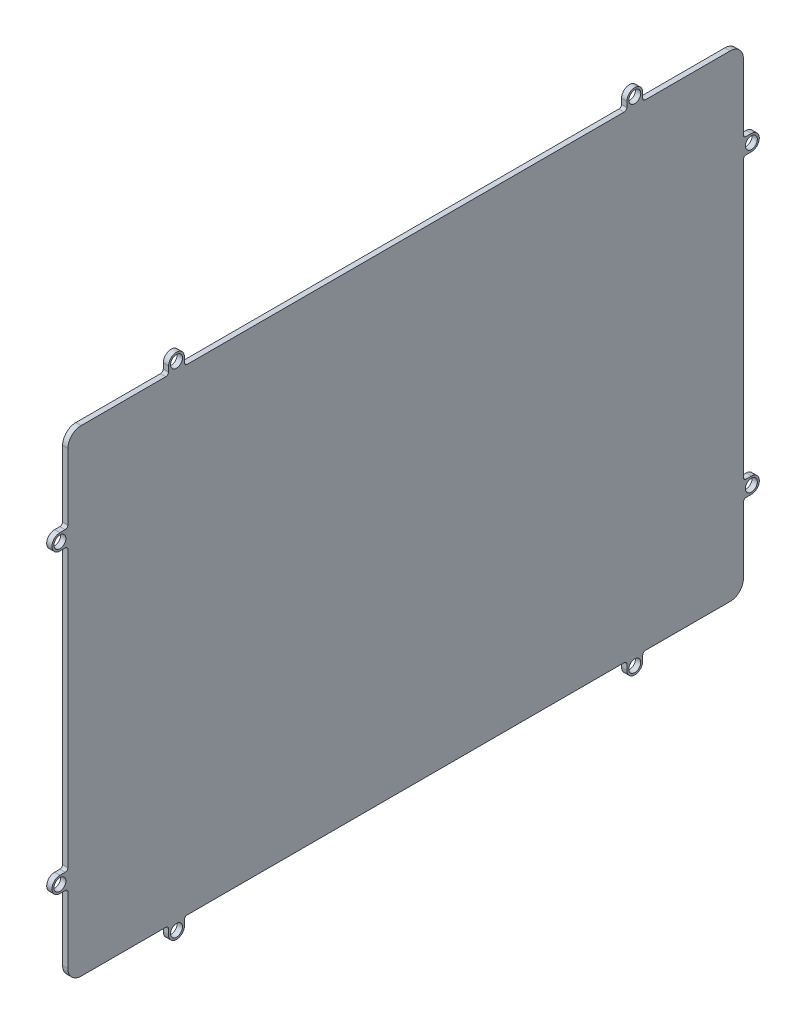
from build123d import *

# Parameters (mm, degrees)
IZIM1_R                     = 1.6
Y_KSEKLIK_EKSTR_ZYON1_DEPTH = 2
IZIM2_R                     = 2.25
KES_EKSTR_ZYON1_DEPTH       = 2
Y_Z_TA_1_OUTLINE_R          = 2.25
Y_Z_TA_1_DEPTH              = 2
Y_Z_TA_1_2_OUTLINE_R        = 2.25
Y_Z_TA_1_2_DEPTH            = 2


# Read off the part's stored shape, not the designer's step: Yüzü Taşı1
with BuildPart() as part:
    # Çizim1 → Yükseklik-Ekstrüzyon1 (new body)
    with BuildSketch(Plane.YZ):
        with BuildLine():
            Line((78.998248848, 127.350175115), (53.998248848, 127.350175115))
            ThreePointArc((53.998248848, 127.350175115), (53.291142067, 127.643068334), (52.998248848, 128.350175115))
            Line((52.998248848, 128.350175115), (52.998248848, 130.350175115))
            ThreePointArc((52.998248848, 130.350175115), (49.998248848, 133.350175115), (46.998248848, 130.350175115))
            Line((46.998248848, 130.350175115), (46.998248848, 128.350175115))
            ThreePointArc((46.998248848, 128.350175115), (46.705355629, 127.643068334), (45.998248848, 127.350175115))
            Line((45.998248848, 127.350175115), (-43.001751152, 127.350175115))
            ThreePointArc((-43.001751152, 127.350175115), (-43.708857933, 127.643068334), (-44.001751152, 128.350175115))
            Line((-44.001751152, 128.350175115), (-44.001751152, 130.350175115))
            ThreePointArc((-44.001751152, 130.350175115), (-47.001751152, 133.350175115), (-50.001751152, 130.350175115))
            Line((-50.001751152, 130.350175115), (-50.001751152, 128.350175115))
            ThreePointArc((-50.001751152, 128.350175115), (-50.294644371, 127.643068334), (-51.001751152, 127.350175115))
            Line((-51.001751152, 127.350175115), (-76.001751152, 127.350175115))
            ThreePointArc((-76.001751152, 127.350175115), (-79.537285058, 125.885709021), (-81.001751152, 122.350175115))
            Line((-81.001751152, 122.350175115), (-81.001751152, 90.350175115))
            ThreePointArc((-81.001751152, 90.350175115), (-81.294644371, 89.643068334), (-82.001751152, 89.350175115))
            Line((-82.001751152, 89.350175115), (-84.001751152, 89.350175115))
            ThreePointArc((-84.001751152, 89.350175115), (-87.001751152, 86.350175115), (-84.001751152, 83.350175115))
            Line((-84.001751152, 83.350175115), (-82.001751152, 83.350175115))
            ThreePointArc((-82.001751152, 83.350175115), (-81.294644371, 83.057281896), (-81.001751152, 82.350175115))
            Line((-81.001751152, 82.350175115), (-81.001751152, -82.649824885))
            ThreePointArc((-81.001751152, -82.649824885), (-81.294644371, -83.356931666), (-82.001751152, -83.649824885))
            Line((-82.001751152, -83.649824885), (-84.001751152, -83.649824885))
            ThreePointArc((-84.001751152, -83.649824885), (-87.001751152, -86.649824885), (-84.001751152, -89.649824885))
            Line((-84.001751152, -89.649824885), (-82.001751152, -89.649824885))
            ThreePointArc((-82.001751152, -89.649824885), (-81.294644371, -89.942718104), (-81.001751152, -90.649824885))
            Line((-81.001751152, -90.649824885), (-81.001751152, -122.649824885))
            ThreePointArc((-81.001751152, -122.649824885), (-79.537285058, -126.185358791), (-76.001751152, -127.649824885))
            Line((-76.001751152, -127.649824885), (-51.001751152, -127.649824885))
            ThreePointArc((-51.001751152, -127.649824885), (-50.294644371, -127.942718104), (-50.001751152, -128.649824885))
            Line((-50.001751152, -128.649824885), (-50.001751152, -130.649824885))
            ThreePointArc((-50.001751152, -130.649824885), (-47.001751152, -133.649824885), (-44.001751152, -130.649824885))
            Line((-44.001751152, -130.649824885), (-44.001751152, -128.649824885))
            ThreePointArc((-44.001751152, -128.649824885), (-43.708857933, -127.942718104), (-43.001751152, -127.649824885))
            Line((-43.001751152, -127.649824885), (45.998248848, -127.649824885))
            ThreePointArc((45.998248848, -127.649824885), (46.705355629, -127.942718104), (46.998248848, -128.649824885))
            Line((46.998248848, -128.649824885), (46.998248848, -130.649824885))
            ThreePointArc((46.998248848, -130.649824885), (49.998248848, -133.649824885), (52.998248848, -130.649824885))
            Line((52.998248848, -130.649824885), (52.998248848, -128.649824885))
            ThreePointArc((52.998248848, -128.649824885), (53.291142067, -127.942718104), (53.998248848, -127.649824885))
            Line((53.998248848, -127.649824885), (78.998248848, -127.649824885))
            ThreePointArc((78.998248848, -127.649824885), (82.533782754, -126.185358791), (83.998248848, -122.649824885))
            Line((83.998248848, -122.649824885), (83.998248848, -90.649824885))
            ThreePointArc((83.998248848, -90.649824885), (84.291142067, -89.942718104), (84.998248848, -89.649824885))
            Line((84.998248848, -89.649824885), (86.998248848, -89.649824885))
            ThreePointArc((86.998248848, -89.649824885), (89.998248848, -86.649824885), (86.998248848, -83.649824885))
            Line((86.998248848, -83.649824885), (84.998248848, -83.649824885))
            ThreePointArc((84.998248848, -83.649824885), (84.291142067, -83.356931666), (83.998248848, -82.649824885))
            Line((83.998248848, -82.649824885), (83.998248848, 82.350175115))
            ThreePointArc((83.998248848, 82.350175115), (84.291142067, 83.057281896), (84.998248848, 83.350175115))
            Line((84.998248848, 83.350175115), (86.998248848, 83.350175115))
            ThreePointArc((86.998248848, 83.350175115), (89.998248848, 86.350175115), (86.998248848, 89.350175115))
            Line((86.998248848, 89.350175115), (84.998248848, 89.350175115))
            ThreePointArc((84.998248848, 89.350175115), (84.291142067, 89.643068334), (83.998248848, 90.350175115))
            Line((83.998248848, 90.350175115), (83.998248848, 122.350175115))
            ThreePointArc((83.998248848, 122.350175115), (82.533782754, 125.885709021), (78.998248848, 127.350175115))
        make_face()
        with Locations(Location((-84.001751152, -86.649824885, 0), (0, 0, 270))):
            Circle(IZIM1_R, mode=Mode.SUBTRACT)
        with Locations(Location((-47.001751152, -130.649824885, 0), (0, 0, 270))):
            Circle(IZIM1_R, mode=Mode.SUBTRACT)
        with Locations(Location((49.998248848, -130.649824885, 0), (0, 0, 270))):
            Circle(IZIM1_R, mode=Mode.SUBTRACT)
        with Locations(Location((86.998248848, -86.649824885, 0), (0, 0, 270))):
            Circle(IZIM1_R, mode=Mode.SUBTRACT)
        with Locations(Location((86.998248848, 86.350175115, 0), (0, 0, 270))):
            Circle(IZIM1_R, mode=Mode.SUBTRACT)
        with Locations(Location((49.998248848, 130.350175115, 0), (0, 0, 270))):
            Circle(IZIM1_R, mode=Mode.SUBTRACT)
        with Locations(Location((-47.001751152, 130.350175115, 0), (0, 0, 270))):
            Circle(IZIM1_R, mode=Mode.SUBTRACT)
        with Locations(Location((-84.001751152, 86.350175115, 0), (0, 0, 270))):
            Circle(IZIM1_R, mode=Mode.SUBTRACT)
    extrude(amount=Y_KSEKLIK_EKSTR_ZYON1_DEPTH)

    # Çizim2 → Kes-Ekstrüzyon1 (cut)
    with BuildSketch(Plane.YZ.offset(2)):
        with Locations(Location((-84.001751152, 86.350175115, 0), (0, 0, 270))):
            Circle(IZIM2_R)
    kes_ekstr_zyon1 = extrude(amount=-KES_EKSTR_ZYON1_DEPTH, mode=Mode.SUBTRACT)

    # Çizim-Çoğaltma1: Kes-Ekstrüzyon1 at 7 more places
    with Locations((0, 37, 44), (0, 134, 44), (0, 171, 0), (0, 171, -173), (0, 134, -217), (0, 37, -217), (0, 0, -173)):
        add(kes_ekstr_zyon1, mode=Mode.SUBTRACT)

    # Yüzü Taşı1 outline → Yüzü Taşı1 (cut)
    # profile 1 of 2: a face of its own
    with BuildSketch(Plane.YZ):
        with BuildLine():
            ThreePointArc((-50.001751152, 128.350175115), (-50.294644371, 127.643068334), (-51.001751152, 127.350175115))
            Line((-51.001751152, 127.350175115), (-43.001751152, 127.350175115))
            ThreePointArc((-43.001751152, 127.350175115), (-43.708857933, 127.643068334), (-44.001751152, 128.350175115))
            Line((-44.001751152, 128.350175115), (-44.001751152, 130.350175115))
            ThreePointArc((-44.001751152, 130.350175115), (-47.001751152, 133.350175115), (-50.001751152, 130.350175115))
            Line((-50.001751152, 130.350175115), (-50.001751152, 128.350175115))
        make_face()
        with Locations((-47.001751152, 130.350175115)):
            Circle(Y_Z_TA_1_OUTLINE_R, mode=Mode.SUBTRACT)
    # profile 2 of 2: a face of its own
    with BuildSketch(Plane.YZ):
        with BuildLine():
            Line((-43.001751152, -127.649824885), (-51.001751152, -127.649824885))
            ThreePointArc((-51.001751152, -127.649824885), (-50.294644371, -127.942718104), (-50.001751152, -128.649824885))
            Line((-50.001751152, -128.649824885), (-50.001751152, -130.649824885))
            ThreePointArc((-50.001751152, -130.649824885), (-47.001751152, -133.649824885), (-44.001751152, -130.649824885))
            Line((-44.001751152, -130.649824885), (-44.001751152, -128.649824885))
            ThreePointArc((-44.001751152, -128.649824885), (-43.708857933, -127.942718104), (-43.001751152, -127.649824885))
        make_face()
        with Locations((-47.001751152, -130.649824885)):
            Circle(Y_Z_TA_1_OUTLINE_R, mode=Mode.SUBTRACT)
    extrude(amount=Y_Z_TA_1_DEPTH, mode=Mode.SUBTRACT)

    # Y_z_ Ta_1 2 outline → Y_z_ Ta_1 2 (add)
    # profile 1 of 5: a face of its own
    with BuildSketch(Plane.YZ):
        with BuildLine():
            Line((-66.001751152, 127.350175115), (-58.001751152, 127.350175115))
            ThreePointArc((-58.001751152, 127.350175115), (-58.708857933, 127.643068334), (-59.001751152, 128.350175115))
            Line((-59.001751152, 128.350175115), (-59.001751152, 130.350175115))
            ThreePointArc((-59.001751152, 130.350175115), (-62.001751152, 133.350175115), (-65.001751152, 130.350175115))
            Line((-65.001751152, 130.350175115), (-65.001751152, 128.350175115))
            ThreePointArc((-65.001751152, 128.350175115), (-65.294644371, 127.643068334), (-66.001751152, 127.350175115))
        make_face()
        with Locations((-62.001751152, 130.350175115)):
            Circle(Y_Z_TA_1_2_OUTLINE_R, mode=Mode.SUBTRACT)
    # profile 2 of 5: a face of its own
    with BuildSketch(Plane.YZ):
        with BuildLine():
            Line((-58.001751152, -127.649824885), (-66.001751152, -127.649824885))
            ThreePointArc((-66.001751152, -127.649824885), (-65.294644371, -127.942718104), (-65.001751152, -128.649824885))
            Line((-65.001751152, -128.649824885), (-65.001751152, -130.649824885))
            ThreePointArc((-65.001751152, -130.649824885), (-62.001751152, -133.649824885), (-59.001751152, -130.649824885))
            Line((-59.001751152, -130.649824885), (-59.001751152, -128.649824885))
            ThreePointArc((-59.001751152, -128.649824885), (-58.708857933, -127.942718104), (-58.001751152, -127.649824885))
        make_face()
        with Locations((-62.001751152, -130.649824885)):
            Circle(Y_Z_TA_1_2_OUTLINE_R, mode=Mode.SUBTRACT)
    # profile 3 of 5: a face of its own
    with BuildSketch(Plane.YZ):
        with BuildLine():
            ThreePointArc((-81.001751152, 122.350175115), (-79.537285058, 125.885709021), (-76.001751152, 127.350175115))
            Line((-76.001751152, 127.350175115), (-91.001751152, 127.350175115))
            ThreePointArc((-91.001751152, 127.350175115), (-94.537285058, 125.885709021), (-96.001751152, 122.350175115))
            Line((-96.001751152, 122.350175115), (-96.001751152, 90.350175115))
            ThreePointArc((-96.001751152, 90.350175115), (-96.294644371, 89.643068334), (-97.001751152, 89.350175115))
            Line((-97.001751152, 89.350175115), (-99.001751152, 89.350175115))
            ThreePointArc((-99.001751152, 89.350175115), (-102.001751152, 86.350175115), (-99.001751152, 83.350175115))
            Line((-99.001751152, 83.350175115), (-97.001751152, 83.350175115))
            ThreePointArc((-97.001751152, 83.350175115), (-96.294644371, 83.057281896), (-96.001751152, 82.350175115))
            Line((-96.001751152, 82.350175115), (-96.001751152, -82.649824885))
            ThreePointArc((-96.001751152, -82.649824885), (-96.294644371, -83.356931666), (-97.001751152, -83.649824885))
            Line((-97.001751152, -83.649824885), (-99.001751152, -83.649824885))
            ThreePointArc((-99.001751152, -83.649824885), (-102.001751152, -86.649824885), (-99.001751152, -89.649824885))
            Line((-99.001751152, -89.649824885), (-97.001751152, -89.649824885))
            ThreePointArc((-97.001751152, -89.649824885), (-96.294644371, -89.942718104), (-96.001751152, -90.649824885))
            Line((-96.001751152, -90.649824885), (-96.001751152, -122.649824885))
            ThreePointArc((-96.001751152, -122.649824885), (-94.537285058, -126.185358791), (-91.001751152, -127.649824885))
            Line((-91.001751152, -127.649824885), (-76.001751152, -127.649824885))
            ThreePointArc((-76.001751152, -127.649824885), (-79.537285058, -126.185358791), (-81.001751152, -122.649824885))
            Line((-81.001751152, -122.649824885), (-81.001751152, -90.649824885))
            ThreePointArc((-81.001751152, -90.649824885), (-81.294644371, -89.942718104), (-82.001751152, -89.649824885))
            Line((-82.001751152, -89.649824885), (-84.001751152, -89.649824885))
            ThreePointArc((-84.001751152, -89.649824885), (-87.001751152, -86.649824885), (-84.001751152, -83.649824885))
            Line((-84.001751152, -83.649824885), (-82.001751152, -83.649824885))
            ThreePointArc((-82.001751152, -83.649824885), (-81.294644371, -83.356931666), (-81.001751152, -82.649824885))
            Line((-81.001751152, -82.649824885), (-81.001751152, 82.350175115))
            ThreePointArc((-81.001751152, 82.350175115), (-81.294644371, 83.057281896), (-82.001751152, 83.350175115))
            Line((-82.001751152, 83.350175115), (-84.001751152, 83.350175115))
            ThreePointArc((-84.001751152, 83.350175115), (-87.001751152, 86.350175115), (-84.001751152, 89.350175115))
            Line((-84.001751152, 89.350175115), (-82.001751152, 89.350175115))
            ThreePointArc((-82.001751152, 89.350175115), (-81.294644371, 89.643068334), (-81.001751152, 90.350175115))
            Line((-81.001751152, 90.350175115), (-81.001751152, 122.350175115))
        make_face()
        with Locations((-99.001751152, -86.649824885)):
            Circle(Y_Z_TA_1_2_OUTLINE_R, mode=Mode.SUBTRACT)
        with Locations((-99.001751152, 86.350175115)):
            Circle(Y_Z_TA_1_2_OUTLINE_R, mode=Mode.SUBTRACT)
    # profile 4 of 5: a face of its own
    with BuildSketch(Plane.YZ):
        with Locations((-84.001751152, 86.350175115)):
            Circle(Y_Z_TA_1_2_OUTLINE_R)
    # profile 5 of 5: a face of its own
    with BuildSketch(Plane.YZ):
        with Locations((-84.001751152, -86.649824885)):
            Circle(Y_Z_TA_1_2_OUTLINE_R)
    extrude(amount=Y_Z_TA_1_2_DEPTH)


solid = part.part
